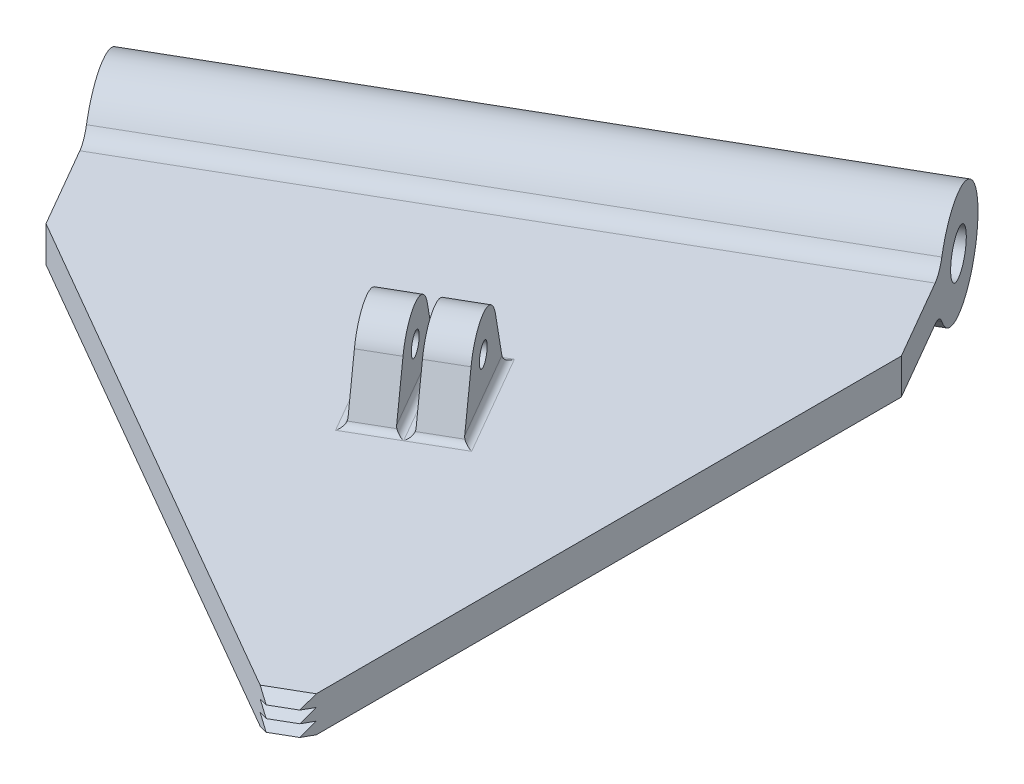
from build123d import *

# Parameters (mm, degrees)
BOSS_EXTRUDE1_DEPTH = 5
SKETCH2_R           = 7.5
BOSS_EXTRUDE2_DEPTH = 87.988181024
SKETCH3_R           = 3
CUT_EXTRUDE1_DEPTH  = 87.988181024
CUT_EXTRUDE2_DEPTH  = 5
BOSS_EXTRUDE3_DEPTH = 6.928203
CUT_EXTRUDE3_START  = -0.5
SKETCH10_W          = 96.059977794
SKETCH10_H          = 5
CUT_EXTRUDE3_DEPTH  = 10.5
BOSS_EXTRUDE4_START = 1
SKETCH11_R          = 1.5
BOSS_EXTRUDE4_DEPTH = 5
FILLET1_R           = 1
FILLET2_R           = 3


with BuildPart() as part:
    # Sketch1 → Boss-Extrude1 (new body)
    with BuildSketch(Plane(origin=(0, 0, 0), x_dir=(1, 0, 0), z_dir=(0, 1, 0))):
        Polygon((0, 87.988181024), (0, 0), (-76.2, 43.994090512), (-91.2, 69.974852626), (-15, 113.968943138), align=None)
    extrude(amount=BOSS_EXTRUDE1_DEPTH)

    # Sketch2 → Boss-Extrude2 (add)
    with BuildSketch(Plane(origin=(-38.1, 0, 21.997045256), x_dir=(0.49999999999999967, 0, 0.8660254037844388), z_dir=(-0.8660254037844388, 0, 0.49999999999999967))):
        with Locations((-99.128932188, 2.5)):
            Circle(SKETCH2_R)
    extrude(amount=-BOSS_EXTRUDE2_DEPTH)

    # Sketch3 → Cut-Extrude1 (cut)
    with BuildSketch(Plane(origin=(-38.1, 0, 21.997045256), x_dir=(0.49999999999999967, 0, 0.8660254037844388), z_dir=(-0.8660254037844388, 0, 0.49999999999999967))):
        with Locations((-99.128932188, 2.5)):
            Circle(SKETCH3_R)
    extrude(amount=-CUT_EXTRUDE1_DEPTH, mode=Mode.SUBTRACT)

    # Sketch5 → Cut-Extrude2 (cut)
    with BuildSketch(Plane(origin=(0, 5, 0), x_dir=(1, 0, 0), z_dir=(0, 1, 0))):
        Polygon((-6, 3.464101615), (0, 6.92820323), (0, 0), align=None)
    extrude(amount=-CUT_EXTRUDE2_DEPTH, mode=Mode.SUBTRACT)

    # Sketch7 → Boss-Extrude3 (add)
    with BuildSketch(Plane(origin=(-3, 0, 1.732050808), x_dir=(0, 1, 0), z_dir=(0.8660254037844383, 0, -0.5000000000000006))):
        Polygon((0.833333333, -4), (0, -6), (1.666666667, -6), align=None)
        Polygon((2.5, -4), (1.666666667, -6), (3.333333333, -6), align=None)
        Polygon((4.166666667, -4), (3.333333333, -6), (5, -6), align=None)
    extrude(amount=BOSS_EXTRUDE3_DEPTH)

    # Sketch10 → Cut-Extrude3 (cut)
    with BuildSketch(Plane(origin=(0, 0, 0), x_dir=(0.8660254037844386, 0, 0.5000000000000001), z_dir=(-0.5000000000000001, 0, 0.8660254037844386)).offset(CUT_EXTRUDE3_START)):
        with Locations((-44.958192127, 2.5)):
            Rectangle(SKETCH10_W, SKETCH10_H)
    cut_extrude3 = extrude(amount=CUT_EXTRUDE3_DEPTH, mode=Mode.SUBTRACT)

    # Mirror1: Cut-Extrude3 across plane
    add(cut_extrude3.mirror(Plane(origin=(0, 0, 0), x_dir=(0.4999999999999997, 0, 0.8660254037844387), z_dir=(0.8660254037844387, 0, -0.49999999999999983))), mode=Mode.SUBTRACT)

    # Sketch11 → Boss-Extrude4 (add)
    with BuildSketch(Plane(origin=(0, 0, 0), x_dir=(-0.49999999999999983, 0, -0.8660254037844387), z_dir=(0.8660254037844387, 0, -0.49999999999999983)).offset(BOSS_EXTRUDE4_START)):
        with BuildLine():
            Line((53.800614721, 12.707564932), (51, 5))
            Line((51, 5), (66, 5))
            Line((66, 5), (63.199385279, 12.707564932))
            ThreePointArc((63.199385279, 12.707564932), (58.5, 16), (53.800614721, 12.707564932))
        make_face()
        with Locations(Location((58.5, 11, 0), (0, 0, 180))):
            Circle(SKETCH11_R, mode=Mode.SUBTRACT)
    boss_extrude4 = extrude(amount=BOSS_EXTRUDE4_DEPTH)

    # Mirror2: Boss-Extrude4 across plane
    add(boss_extrude4.mirror(Plane(origin=(0, 0, 0), x_dir=(0.4999999999999997, 0, 0.8660254037844387), z_dir=(0.8660254037844387, 0, -0.49999999999999983))))

    # Fillet1
    fillet1_edges = [part.edges().sort_by_distance(p)[0] for p in [
        (-24.053847577, 5, -53.662486121),
        (-28.383974596, 5, -51.162486121),
        (-22.468911087, 5, -45.917295593),
        (-29.968911087, 5, -58.90767665),
        (-34.446152423, 5, -47.662486121),
        (-36.031088913, 5, -55.40767665),
        (-28.531088913, 5, -42.417295593),
        (-30.116025404, 5, -50.162486121),
    ]]
    fillet(fillet1_edges, radius=FILLET1_R - 0.0001)  # a hair under: the kernel refuses the full size

    # Fillet2
    fillet2_edges = [part.edges().sort_by_distance(p)[0] for p in [
        (-46.028932188, 0, -79.724449168),
        (-46.028932188, 5, -79.724449168),
    ]]
    fillet(fillet2_edges, radius=FILLET2_R)


solid = part.part
